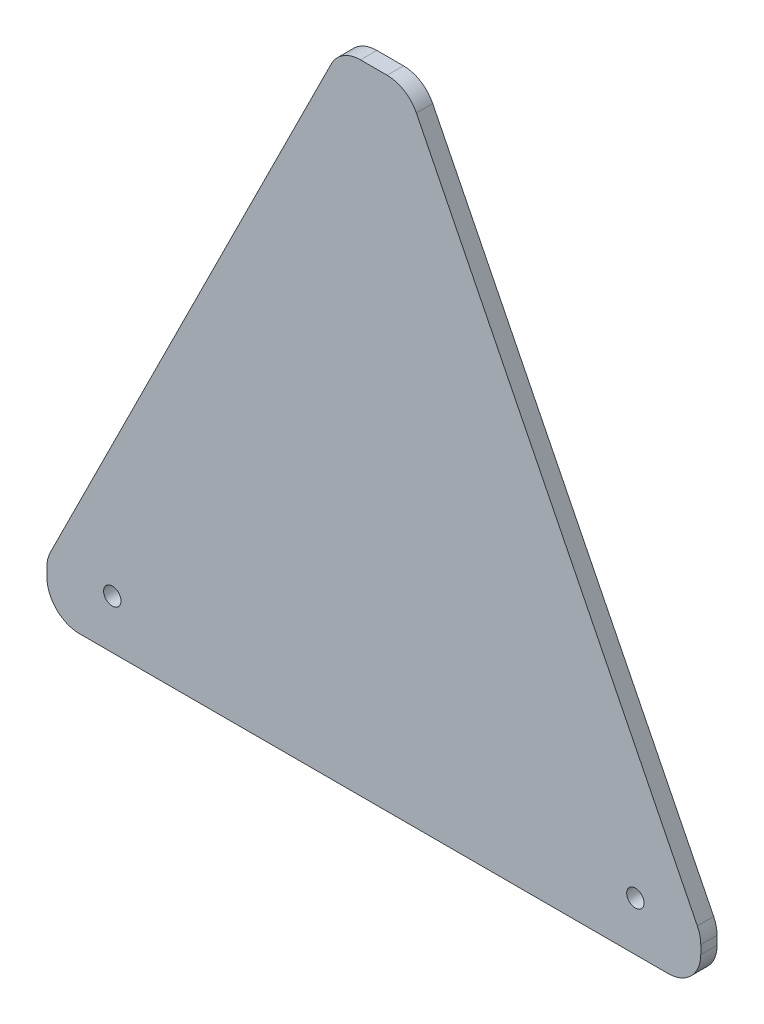
from build123d import *

# Parameters (mm, degrees)
SKETCH1_R           = 3.3734375
BOSS_EXTRUDE1_DEPTH = 6.35
FILLET2_R           = 12.7


with BuildPart() as part:
    # Sketch1 → Boss-Extrude1 (new body)
    with BuildSketch(Plane.XY):
        Polygon((0, 0), (254, 0), (254, 19.05), (140.024244399, 247.65), (113.975755601, 247.65), (0, 19.05), align=None)
        with Locations((25.4, 19.05)):
            Circle(SKETCH1_R, mode=Mode.SUBTRACT)
        with Locations((228.6, 19.05)):
            Circle(SKETCH1_R, mode=Mode.SUBTRACT)
    extrude(amount=BOSS_EXTRUDE1_DEPTH)

    # Fillet2
    fillet2_edges = [part.edges().sort_by_distance(p)[0] for p in [
        (113.975755601, 247.65, 3.175),
        (140.024244399, 247.65, 3.175),
        (254, 19.05, 3.175),
        (254, 0, 3.175),
        (0, 0, 3.175),
        (0, 19.05, 3.175),
    ]]
    fillet(fillet2_edges, radius=FILLET2_R)


solid = part.part
